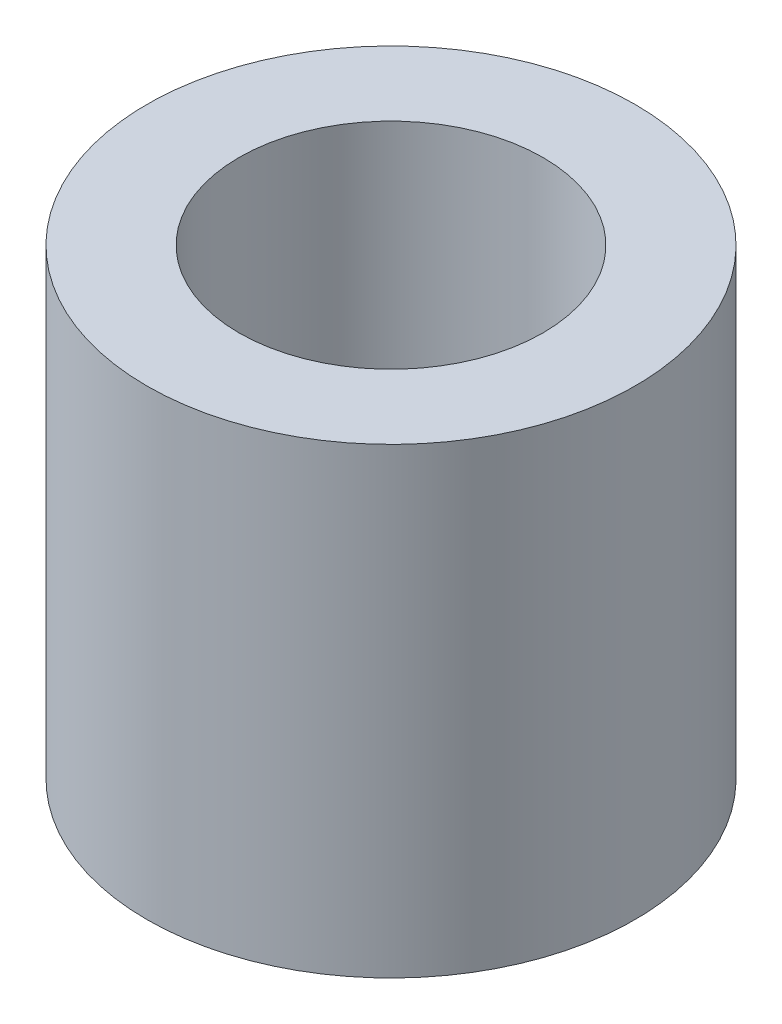
from build123d import *

# Parameters (mm, degrees)
SKETCH1_R           = 10
BOSS_EXTRUDE1_DEPTH = 18.94088005
SKETCH2_R           = 6.228875691
CUT_EXTRUDE1_DEPTH  = 24.638040043


with BuildPart() as part:
    # Sketch1 → Boss-Extrude1 (new body)
    with BuildSketch(Plane(origin=(0, 0, 0), x_dir=(1, 0, 0), z_dir=(0, 1, 0))):
        Circle(SKETCH1_R)
    extrude(amount=BOSS_EXTRUDE1_DEPTH)

    # Sketch2 → Cut-Extrude1 (cut, through all)
    with BuildSketch(Plane(origin=(0, 0, 0), x_dir=(1, 0, 0), z_dir=(0, 1, 0))):
        Circle(SKETCH2_R)
    extrude(amount=CUT_EXTRUDE1_DEPTH, mode=Mode.SUBTRACT)


solid = part.part
